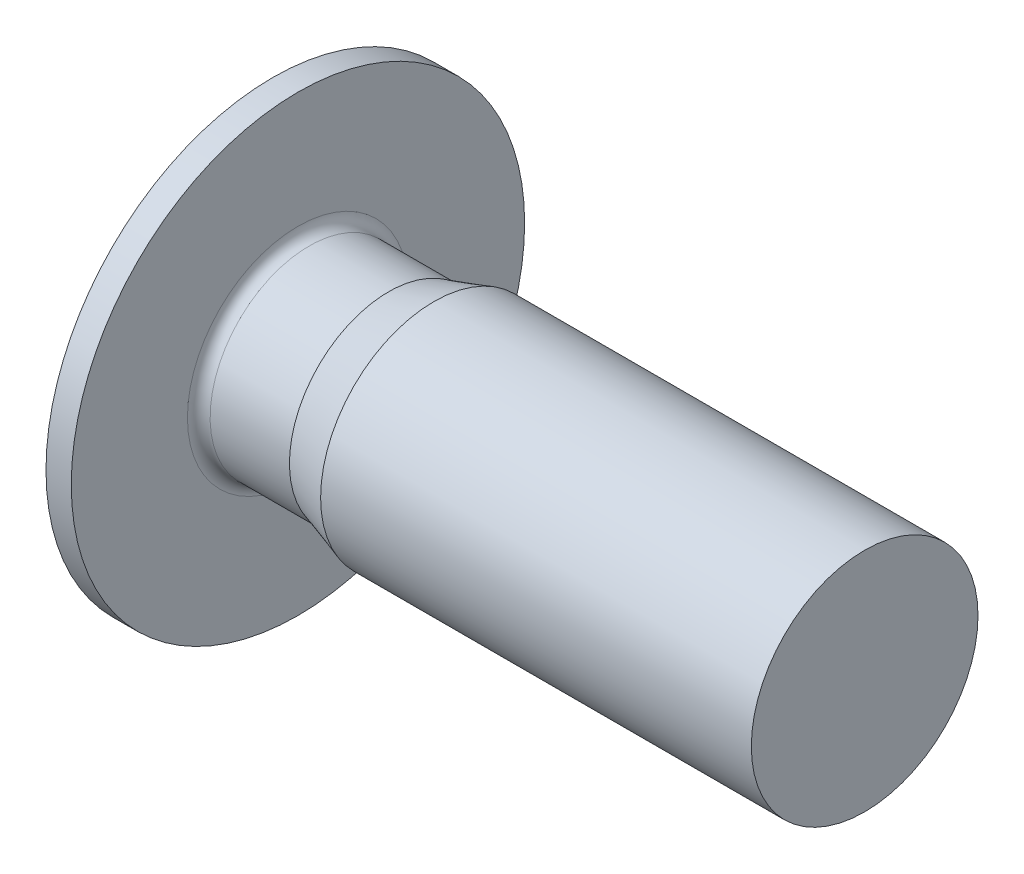
from build123d import *

# Parameters (mm, degrees)
FILLET1_R          = 0.1
CUT_EXTRUDE1_DEPTH = 1.2


with BuildPart() as part:
    # Sketch1 → Revolve1 (revolve)
    with BuildSketch(Plane.XY):
        Polygon((-0.5, 0), (-0.5, 1.52), (-0.222871871, 2), (0, 2), (0, 0.875), (0.8, 0.875), (1.2, 1), (5, 1), (5, 0), align=None)
    revolve(axis=Axis((-0.5, 0, 0), (1, 0, 0)))

    # Fillet1
    fillet1_edges = [part.edges().sort_by_distance(p)[0] for p in [
        (0, -0.875, 0),
    ]]
    fillet(fillet1_edges, radius=FILLET1_R)

    # Sketch2 → Cut-Extrude1 (cut)
    with BuildSketch(Plane.ZY.offset(0.5)):
        Polygon((0, 0.75055535), (-0.65, 0.375277675), (-0.65, -0.375277675), (0, -0.75055535), (0.65, -0.375277675), (0.65, 0.375277675), align=None)
    extrude(amount=-CUT_EXTRUDE1_DEPTH, mode=Mode.SUBTRACT)

    # Sketch3 → Cut-Revolve1 (revolve, cut)
    with BuildSketch(Plane.XY):
        Polygon((0.7, 0), (0.7, 0.65), (1.090559402, 0), align=None)
    revolve(axis=Axis((0.7, 0, 0), (1, 0, 0)), mode=Mode.SUBTRACT)


solid = part.part
